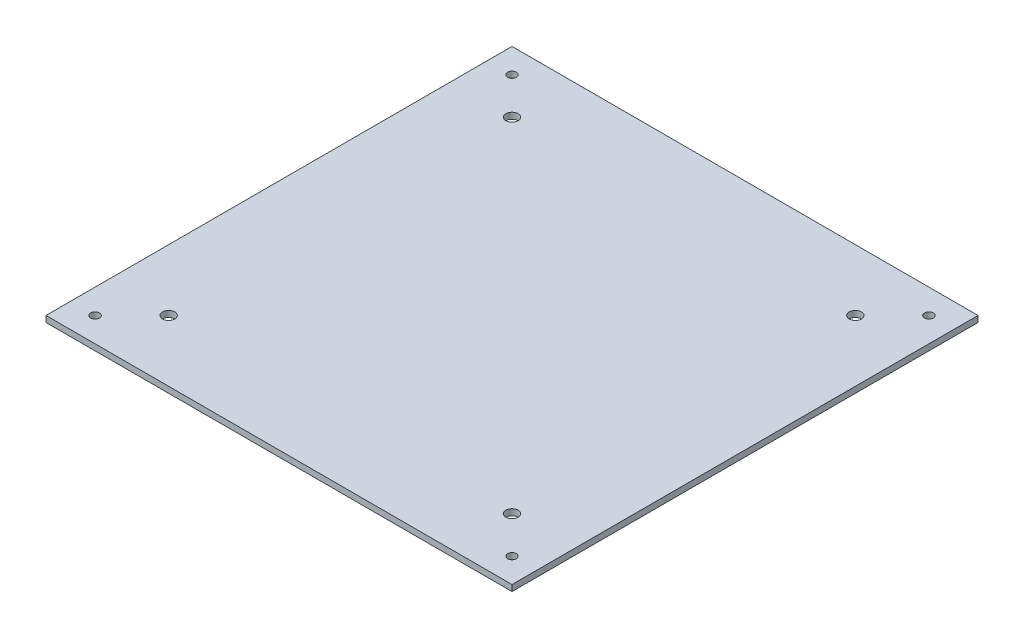
from build123d import *

# Parameters (mm, degrees)
SKETCH1_W           = 241.3
SKETCH1_H           = 241.3
BOSS_EXTRUDE1_DEPTH = 3.175
SKETCH2_R           = 3.175
SKETCH2_R_2         = 2.286
CUT_EXTRUDE1_DEPTH  = 342.264502439


with BuildPart() as part:
    # Sketch1 → Boss-Extrude1 (new body)
    with BuildSketch(Plane(origin=(0, 0, 0), x_dir=(1, 0, 0), z_dir=(0, 1, 0))):
        with Locations((120.65, 120.65)):
            Rectangle(SKETCH1_W, SKETCH1_H)
    extrude(amount=BOSS_EXTRUDE1_DEPTH)

    # Sketch2 → Cut-Extrude1 (cut, through all)
    with BuildSketch(Plane(origin=(0, 3.175, 0), x_dir=(1, 0, 0), z_dir=(0, 1, 0))):
        with Locations((209.55, 31.75)):
            Circle(SKETCH2_R)
        with Locations((31.75, 31.75)):
            Circle(SKETCH2_R)
        with Locations((31.75, 209.55)):
            Circle(SKETCH2_R)
        with Locations((209.55, 209.55)):
            Circle(SKETCH2_R)
        with Locations((228.6, 12.7)):
            Circle(SKETCH2_R_2)
        with Locations((12.7, 12.7)):
            Circle(SKETCH2_R_2)
        with Locations((12.7, 228.6)):
            Circle(SKETCH2_R_2)
        with Locations((228.6, 228.6)):
            Circle(SKETCH2_R_2)
    extrude(amount=-CUT_EXTRUDE1_DEPTH, mode=Mode.SUBTRACT)


solid = part.part
